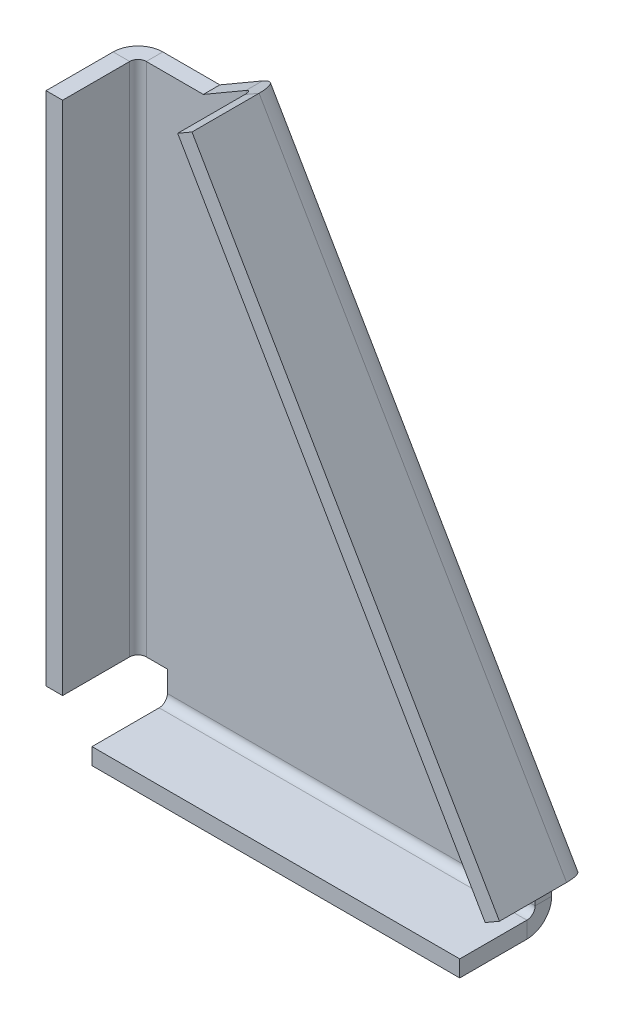
from build123d import *

# Parameters (mm, degrees)
BASE_FLANGE1_DEPTH             = 2.286
EDGE_FLANGE1_STRIP_W           = 11.43
EDGE_FLANGE1_STRIP_H           = 2.286
EDGE_FLANGE1_STRIP_CUT_DEPTH   = 71.239731207
EDGE_FLANGE1_STRIP_2_W         = 11.43
EDGE_FLANGE1_STRIP_2_H         = 2.286
EDGE_FLANGE1_STRIP_CUT_2_DEPTH = 50.8
EDGE_FLANGE1_STRIP_3_W         = 11.43
EDGE_FLANGE1_STRIP_3_H         = 2.286
EDGE_FLANGE1_STRIP_CUT_3_DEPTH = 84.622425054
EDGE_FLANGE1_DEPTH             = 71.239731207
EDGE_FLANGE1_BEND_DEPTH        = 50.8
EDGE_FLANGE1_BEND_2_DEPTH      = 84.622425054


# Sheet-metal steps are written as plain solids
with BuildPart() as part:
    # Sketch1 → Base-Flange1 (new body)
    with BuildSketch(Plane.XY):
        Polygon((0, 0), (0, -6.35), (50.8, -6.35), (50.8, 0), (56.291897179, 3.187721032), (13.811159523, 76.374753696), (4.964395568, 71.239731207), (-6.35, 71.239731207), (-6.35, 0), align=None)
    extrude(amount=-BASE_FLANGE1_DEPTH)

    # Edge-Flange1 strip (across the edge) → Edge-Flange1 strip cut (cut)
    with BuildSketch(Plane(origin=(-6.35, 71.239731207, 0), x_dir=(1, 0, 0), z_dir=(0, -1, 0))):
        with Locations((-2.286, -1.143)):
            Rectangle(EDGE_FLANGE1_STRIP_W, EDGE_FLANGE1_STRIP_H)
    extrude(amount=EDGE_FLANGE1_STRIP_CUT_DEPTH, mode=Mode.SUBTRACT)

    # Edge-Flange1 strip 2 (across the edge) → Edge-Flange1 strip cut 2 (cut)
    with BuildSketch(Plane(origin=(0, -6.35, 0), x_dir=(0, 1, 0), z_dir=(1, 0, 0))):
        with Locations((-2.286, -1.143)):
            Rectangle(EDGE_FLANGE1_STRIP_2_W, EDGE_FLANGE1_STRIP_2_H)
    extrude(amount=EDGE_FLANGE1_STRIP_CUT_2_DEPTH, mode=Mode.SUBTRACT)

    # Edge-Flange1 strip 3 (across the edge) → Edge-Flange1 strip cut 3 (cut)
    with BuildSketch(Plane(origin=(56.291897179, 3.187721032, 0), x_dir=(-0.8648656974537777, -0.5020033121083872, 3.491481338843133e-15), z_dir=(-0.5020033121083872, 0.8648656974537777, 0))):
        with Locations((-2.286, -1.143)):
            Rectangle(EDGE_FLANGE1_STRIP_3_W, EDGE_FLANGE1_STRIP_3_H)
    extrude(amount=EDGE_FLANGE1_STRIP_CUT_3_DEPTH, mode=Mode.SUBTRACT)

    # Edge-Flange1 section (across the edge) → Edge-Flange1 (add)
    with BuildSketch(Plane(origin=(-6.35, 71.239731207, 0), x_dir=(1, 0, 0), z_dir=(0, -1, 0))):
        with BuildLine():
            Line((0, 1.143), (0, 10.414))
            Line((0, 10.414), (2.286, 10.414))
            Line((2.286, 10.414), (2.286, 1.143))
            ThreePointArc((2.286, 1.143), (2.620776949, 0.334776949), (3.429, 0))
            Line((3.429, 0), (3.429, -2.286))
            ThreePointArc((3.429, -2.286), (1.004330847, -1.281669153), (0, 1.143))
        make_face()
    extrude(amount=EDGE_FLANGE1_DEPTH)

    # Edge-Flange1 section 2 (across the edge) → Edge-Flange1 bend (add)
    with BuildSketch(Plane(origin=(0, -6.35, 0), x_dir=(0, 1, 0), z_dir=(1, 0, 0))):
        with BuildLine():
            Line((0, 1.143), (0, 10.414))
            Line((0, 10.414), (2.286, 10.414))
            Line((2.286, 10.414), (2.286, 1.143))
            ThreePointArc((2.286, 1.143), (2.620776949, 0.334776949), (3.429, 0))
            Line((3.429, 0), (3.429, -2.286))
            ThreePointArc((3.429, -2.286), (1.004330847, -1.281669153), (0, 1.143))
        make_face()
    extrude(amount=EDGE_FLANGE1_BEND_DEPTH)

    # Edge-Flange1 section 3 (across the edge) → Edge-Flange1 bend 2 (add)
    with BuildSketch(Plane(origin=(56.291897179, 3.187721032, 0), x_dir=(-0.8648656974537777, -0.5020033121083872, 3.491481338843133e-15), z_dir=(-0.5020033121083872, 0.8648656974537777, 0))):
        with BuildLine():
            Line((0, 1.143), (0, 10.414))
            Line((0, 10.414), (2.286, 10.414))
            Line((2.286, 10.414), (2.286, 1.143))
            ThreePointArc((2.286, 1.143), (2.620776949, 0.334776949), (3.429, 0))
            Line((3.429, 0), (3.429, -2.286))
            ThreePointArc((3.429, -2.286), (1.004330847, -1.281669153), (0, 1.143))
        make_face()
    extrude(amount=EDGE_FLANGE1_BEND_2_DEPTH)


solid = part.part
